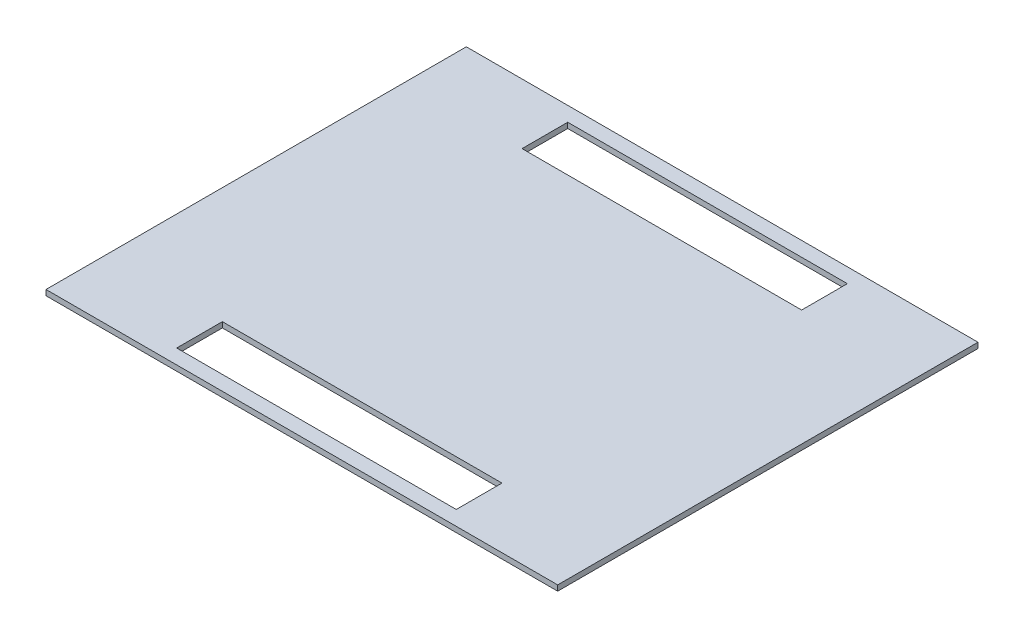
from build123d import *

# Parameters (mm, degrees)
SKETCH1_W           = 280
SKETCH1_H           = 230
BOSS_EXTRUDE1_DEPTH = 3
SKETCH4_W           = 153
SKETCH4_H           = 25
CUT_EXTRUDE2_DEPTH  = 363.365837242


with BuildPart() as part:
    # Sketch1 → Boss-Extrude1 (new body)
    with BuildSketch(Plane(origin=(0, 0, 0), x_dir=(1, 0, 0), z_dir=(0, 1, 0))):
        with Locations((-140, 115)):
            Rectangle(SKETCH1_W, SKETCH1_H)
    extrude(amount=BOSS_EXTRUDE1_DEPTH)

    # Sketch4 → Cut-Extrude2 (cut, through all)
    with BuildSketch(Plane(origin=(0, 3, 0), x_dir=(1, 0, 0), z_dir=(0, 1, 0))):
        with Locations((-140, 209.5)):
            Rectangle(SKETCH4_W, SKETCH4_H)
        with Locations((-140, 20.5)):
            Rectangle(SKETCH4_W, SKETCH4_H)
    extrude(amount=-CUT_EXTRUDE2_DEPTH, mode=Mode.SUBTRACT)


solid = part.part
